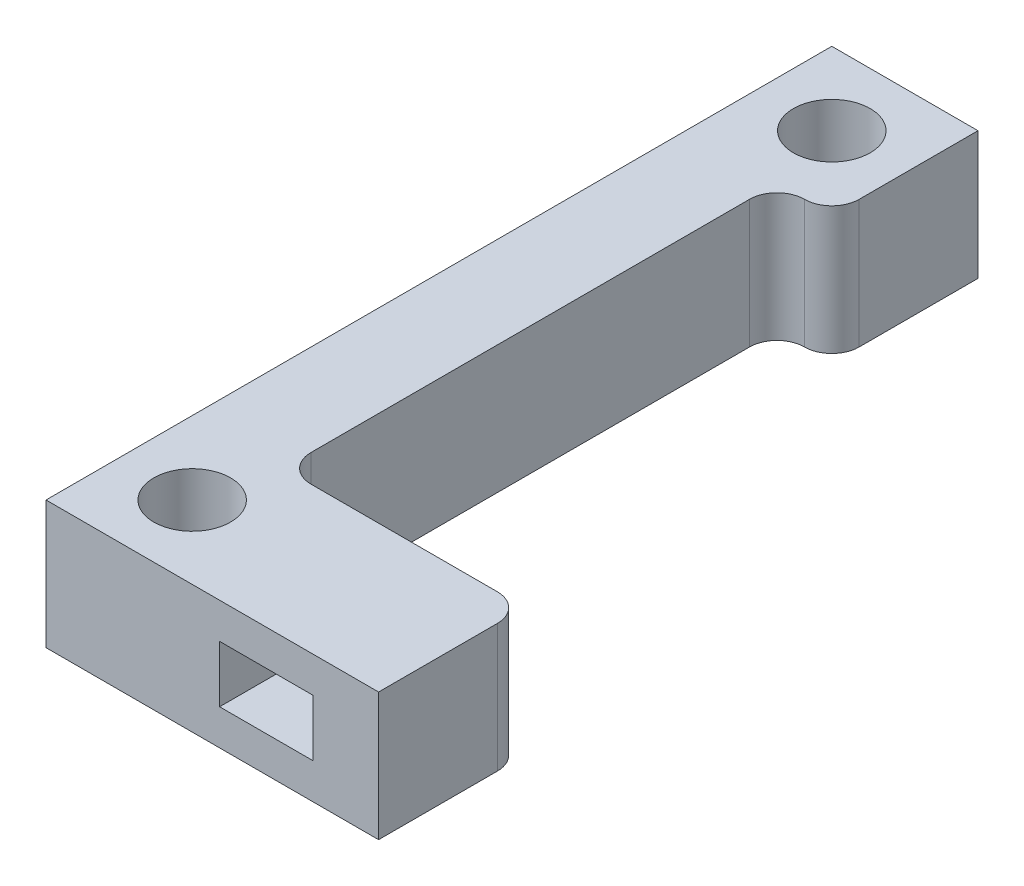
from build123d import *

# Parameters (mm, degrees)
BOSS_EXTRUDE1_DEPTH = 7
CUT_EXTRUDE1_REACH  = 49.215
SKETCH2_W           = 5.1
SKETCH2_H           = 3.1
CUT_EXTRUDE2_REACH  = 49.215
SKETCH3_R           = 2.1
FILLET1_START       = -1
FILLET1_DEPTH       = 9
FILLET1_2_DEPTH     = 7


with BuildPart() as part:
    # Sketch1 → Boss-Extrude1 (new body)
    with BuildSketch(Plane(origin=(0, 0, 0), x_dir=(1, 0, 0), z_dir=(0, 1, 0))):
        Polygon((0, 0), (18.2, 0), (18.2, 8), (5, 8), (5, 35), (8, 35), (8, 43), (0, 43), align=None)
    extrude(amount=BOSS_EXTRUDE1_DEPTH)

    # Sketch2 → Cut-Extrude1 (cut, up to next)
    with BuildSketch(Plane.XY, mode=Mode.PRIVATE) as cut_extrude1_sk1:
        with Locations((12.05, 3.5)):
            Rectangle(SKETCH2_W, SKETCH2_H)
    cut_extrude1_tool1 = extrude(cut_extrude1_sk1.sketch, amount=-CUT_EXTRUDE1_REACH, mode=Mode.PRIVATE) & part.part
    add(cut_extrude1_tool1.solids().sort_by_distance((12.05, 3.5, 0))[0], mode=Mode.SUBTRACT)

    # Sketch3 → Cut-Extrude2 (cut, up to next)
    with BuildSketch(Plane(origin=(0, 7, 0), x_dir=(1, 0, 0), z_dir=(0, 1, 0)), mode=Mode.PRIVATE) as cut_extrude2_sk1:
        with Locations(Location((4, 39, 0), (0, 0, 270))):
            Circle(SKETCH3_R)
    cut_extrude2_tool1 = extrude(cut_extrude2_sk1.sketch, amount=-CUT_EXTRUDE2_REACH, mode=Mode.PRIVATE) & part.part
    # Sketch3 → Cut-Extrude2 (cut, up to next)
    with BuildSketch(Plane(origin=(0, 7, 0), x_dir=(1, 0, 0), z_dir=(0, 1, 0)), mode=Mode.PRIVATE) as cut_extrude2_sk2:
        with Locations(Location((4, 4, 0), (0, 0, 270))):
            Circle(SKETCH3_R)
    cut_extrude2_tool2 = extrude(cut_extrude2_sk2.sketch, amount=-CUT_EXTRUDE2_REACH, mode=Mode.PRIVATE) & part.part
    add(cut_extrude2_tool1.solids().sort_by_distance((4, 7, -39))[0], mode=Mode.SUBTRACT)
    add(cut_extrude2_tool2.solids().sort_by_distance((4, 7, -4))[0], mode=Mode.SUBTRACT)

    # Fillet1: read off the stored shape, not the designer's step
    # Fillet1 outline → Fillet1 (cut)
    with BuildSketch(Plane(origin=(0, 0, 0), x_dir=(1, 0, 0), z_dir=(0, 1, 0)).offset(FILLET1_START)):
        with BuildLine():
            Line((18.2, 8), (16.7, 8))
            ThreePointArc((16.7, 8), (17.760660172, 7.560660172), (18.2, 6.5))
            Line((18.2, 6.5), (18.2, 8))
        make_face()
        with BuildLine():
            ThreePointArc((8, 36.5), (7.560660172, 35.439339828), (6.5, 35))
            Line((6.5, 35), (8, 35))
            Line((8, 35), (8, 36.5))
        make_face()
    extrude(amount=FILLET1_DEPTH, mode=Mode.SUBTRACT)

    # Fillet1 2 outline → Fillet1 2 (add)
    with BuildSketch(Plane(origin=(0, 0, 0), x_dir=(1, 0, 0), z_dir=(0, 1, 0))):
        with BuildLine():
            Line((5, 35), (5, 33.5))
            ThreePointArc((5, 33.5), (5.439339828, 34.560660172), (6.5, 35))
            Line((6.5, 35), (5, 35))
        make_face()
        with BuildLine():
            Line((5, 8), (6.5, 8))
            ThreePointArc((6.5, 8), (5.439339828, 8.439339828), (5, 9.5))
            Line((5, 9.5), (5, 8))
        make_face()
    extrude(amount=FILLET1_2_DEPTH)


solid = part.part
